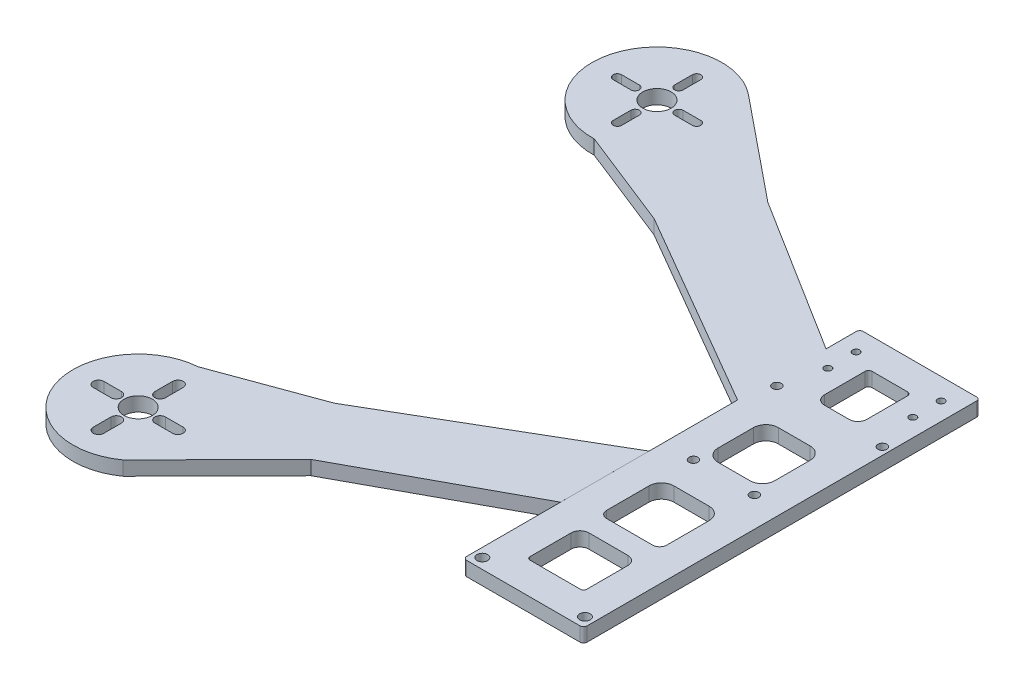
from build123d import *

# Parameters (mm, degrees)
FRAME_SKETCH_R           = 4
FRAME_SKETCH_R_2         = 1.5
FRAME_SKETCH_R_3         = 1
FRAME_SKETCH_R_4         = 1.25
FRAME_BOTTOM_PLATE_DEPTH = 4


with BuildPart() as part:
    # Frame Sketch → Frame Bottom Plate (new body)
    # profile 1 of 3: a face of its own
    with BuildSketch(Plane(origin=(0, 0, 0), x_dir=(1, 0, 0), z_dir=(0, 1, 0))):
        with BuildLine():
            Line((-17, 46.5), (-61.062067613, 74.114021758))
            Line((-61.062067613, 74.114021758), (-90.178997264, 97.745661728))
            ThreePointArc((-90.178997264, 97.745661728), (-119.163624581, 89.331166153), (-101.129958296, 65.129942282))
            Line((-101.129958296, 65.129942282), (-73.225666601, 54.114021758))
            Line((-73.225666601, 54.114021758), (-17, 21.5))
            Line((-17, 21.5), (-17, 46.5))
        make_face()
        with Locations((-101.752821055, 83.485364368)):
            Circle(FRAME_SKETCH_R, mode=Mode.SUBTRACT)
        with BuildLine():
            Line((-100.549362347, 94.665341394), (-100.549362347, 89.665341394))
            ThreePointArc((-100.549362347, 89.665341394), (-101.752821055, 88.461882686), (-102.956279762, 89.665341394))
            Line((-102.956279762, 89.665341394), (-102.956279762, 94.665341394))
            ThreePointArc((-102.956279762, 94.665341394), (-101.752821055, 95.868800102), (-100.549362347, 94.665341394))
        make_face(mode=Mode.SUBTRACT)
        with BuildLine():
            Line((-100.549362347, 72.305387341), (-100.549362347, 77.305387341))
            ThreePointArc((-100.549362347, 77.305387341), (-101.752821055, 78.508846049), (-102.956279762, 77.305387341))
            Line((-102.956279762, 77.305387341), (-102.956279762, 72.305387341))
            ThreePointArc((-102.956279762, 72.305387341), (-101.752821055, 71.101928634), (-100.549362347, 72.305387341))
        make_face(mode=Mode.SUBTRACT)
        with BuildLine():
            Line((-112.952821055, 84.685364368), (-107.952821055, 84.685364368))
            ThreePointArc((-107.952821055, 84.685364368), (-106.752821055, 83.485364368), (-107.952821055, 82.285364368))
            Line((-107.952821055, 82.285364368), (-112.952821055, 82.285364368))
            ThreePointArc((-112.952821055, 82.285364368), (-114.152821055, 83.485364368), (-112.952821055, 84.685364368))
        make_face(mode=Mode.SUBTRACT)
        with BuildLine():
            Line((-90.552821055, 84.685364368), (-95.552821055, 84.685364368))
            ThreePointArc((-95.552821055, 84.685364368), (-96.752821055, 83.485364368), (-95.552821055, 82.285364368))
            Line((-95.552821055, 82.285364368), (-90.552821055, 82.285364368))
            ThreePointArc((-90.552821055, 82.285364368), (-89.352821055, 83.485364368), (-90.552821055, 84.685364368))
        make_face(mode=Mode.SUBTRACT)
    # profile 2 of 3: a face of its own
    with BuildSketch(Plane(origin=(0, 0, 0), x_dir=(1, 0, 0), z_dir=(0, 1, 0))):
        with BuildLine():
            Line((-16, 56), (16, 56))
            ThreePointArc((16, 56), (16.707106781, 55.707106781), (17, 55))
            Line((17, 55), (17, -55))
            ThreePointArc((17, -55), (16.707106781, -55.707106781), (16, -56))
            Line((16, -56), (-16, -56))
            ThreePointArc((-16, -56), (-16.707106781, -55.707106781), (-17, -55))
            Line((-17, -55), (-17, 55))
            ThreePointArc((-17, 55), (-16.707106781, 55.707106781), (-16, 56))
        make_face()
        with Locations((-14.5, -53.1)):
            Circle(FRAME_SKETCH_R_2, mode=Mode.SUBTRACT)
        with Locations((14.5, -53.1)):
            Circle(FRAME_SKETCH_R_2, mode=Mode.SUBTRACT)
        with Locations((12, 50)):
            Circle(FRAME_SKETCH_R_3, mode=Mode.SUBTRACT)
        with Locations((12, 42)):
            Circle(FRAME_SKETCH_R_3, mode=Mode.SUBTRACT)
        with Locations((-12, 50)):
            Circle(FRAME_SKETCH_R_3, mode=Mode.SUBTRACT)
        with Locations((-12, 42)):
            Circle(FRAME_SKETCH_R_3, mode=Mode.SUBTRACT)
        with Locations((-14.9, 30.5)):
            Circle(FRAME_SKETCH_R_4, mode=Mode.SUBTRACT)
        with Locations((-8.601916271, 0.640393786)):
            Circle(FRAME_SKETCH_R_4, mode=Mode.SUBTRACT)
        with Locations((8.601916271, 0.640393786)):
            Circle(FRAME_SKETCH_R_4, mode=Mode.SUBTRACT)
        with Locations((14.9, 30.5)):
            Circle(FRAME_SKETCH_R_4, mode=Mode.SUBTRACT)
        with BuildLine():
            Line((-7.140393786, -47), (7.140393786, -47))
            ThreePointArc((7.140393786, -47), (7.748227169, -46.748227169), (8, -46.140393786))
            Line((8, -46.140393786), (8, -34.5))
            ThreePointArc((8, -34.5), (7.267766953, -32.732233047), (5.5, -32))
            Line((5.5, -32), (-5.5, -32))
            ThreePointArc((-5.5, -32), (-7.267766953, -32.732233047), (-8, -34.5))
            Line((-8, -34.5), (-8, -46.140393786))
            ThreePointArc((-8, -46.140393786), (-7.748227169, -46.748227169), (-7.140393786, -47))
        make_face(mode=Mode.SUBTRACT)
        with BuildLine():
            Line((6.5, -26), (-6.5, -26))
            ThreePointArc((-6.5, -26), (-7.914213562, -25.414213562), (-8.5, -24))
            Line((-8.5, -24), (-8.5, -12))
            ThreePointArc((-8.5, -12), (-7.474873734, -9.525126266), (-5, -8.5))
            Line((-5, -8.5), (5, -8.5))
            ThreePointArc((5, -8.5), (7.474873734, -9.525126266), (8.5, -12))
            Line((8.5, -12), (8.5, -24))
            ThreePointArc((8.5, -24), (7.914213562, -25.414213562), (6.5, -26))
        make_face(mode=Mode.SUBTRACT)
        with BuildLine():
            Line((-4.5, 3.5), (4.5, 3.5))
            ThreePointArc((4.5, 3.5), (6.974873734, 4.525126266), (8, 7))
            Line((8, 7), (8, 17))
            ThreePointArc((8, 17), (6.974873734, 19.474873734), (4.5, 20.5))
            Line((4.5, 20.5), (-4.5, 20.5))
            ThreePointArc((-4.5, 20.5), (-6.974873734, 19.474873734), (-8, 17))
            Line((-8, 17), (-8, 7))
            ThreePointArc((-8, 7), (-6.974873734, 4.525126266), (-4.5, 3.5))
        make_face(mode=Mode.SUBTRACT)
        with BuildLine():
            Line((-3.5, 32.5), (3.5, 32.5))
            ThreePointArc((3.5, 32.5), (5.267766953, 33.232233047), (6, 35))
            Line((6, 35), (6, 46.5))
            ThreePointArc((6, 46.5), (5.707106781, 47.207106781), (5, 47.5))
            Line((5, 47.5), (-5, 47.5))
            ThreePointArc((-5, 47.5), (-5.707106781, 47.207106781), (-6, 46.5))
            Line((-6, 46.5), (-6, 35))
            ThreePointArc((-6, 35), (-5.267766953, 33.232233047), (-3.5, 32.5))
        make_face(mode=Mode.SUBTRACT)
    # profile 3 of 3: a face of its own
    with BuildSketch(Plane(origin=(0, 0, 0), x_dir=(1, 0, 0), z_dir=(0, 1, 0))):
        with BuildLine():
            Line((-62.716323121, -53.281543085), (-89.097855804, -79.932335442))
            ThreePointArc((-89.097855804, -79.932335442), (-117.171371962, -71.292831267), (-101.325361156, -46.560923064))
            Line((-101.325361156, -46.560923064), (-73.161757849, -36.225960617))
            Line((-73.161757849, -36.225960617), (-17.001171136, -3.499999973))
            Line((-17.001171136, -3.499999973), (-17.001171136, -28.499999973))
            Line((-17.001171136, -28.499999973), (-62.716323121, -53.281543085))
        make_face()
        with Locations((-99.852332897, -64.947021253)):
            Circle(FRAME_SKETCH_R, mode=Mode.SUBTRACT)
        with BuildLine():
            Line((-98.352332897, -53.747021253), (-98.352332897, -58.747021253))
            ThreePointArc((-98.352332897, -58.747021253), (-99.852332897, -60.247021253), (-101.352332897, -58.747021253))
            Line((-101.352332897, -58.747021253), (-101.352332897, -53.747021253))
            ThreePointArc((-101.352332897, -53.747021253), (-99.852332897, -52.247021253), (-98.352332897, -53.747021253))
        make_face(mode=Mode.SUBTRACT)
        with BuildLine():
            Line((-98.352332897, -76.147021253), (-98.352332897, -71.147021253))
            ThreePointArc((-98.352332897, -71.147021253), (-99.852332897, -69.647021253), (-101.352332897, -71.147021253))
            Line((-101.352332897, -71.147021253), (-101.352332897, -76.147021253))
            ThreePointArc((-101.352332897, -76.147021253), (-99.852332897, -77.647021253), (-98.352332897, -76.147021253))
        make_face(mode=Mode.SUBTRACT)
        with BuildLine():
            Line((-111.052332897, -63.447021253), (-106.052332897, -63.447021253))
            ThreePointArc((-106.052332897, -63.447021253), (-104.552332897, -64.947021253), (-106.052332897, -66.447021253))
            Line((-106.052332897, -66.447021253), (-111.052332897, -66.447021253))
            ThreePointArc((-111.052332897, -66.447021253), (-112.552332897, -64.947021253), (-111.052332897, -63.447021253))
        make_face(mode=Mode.SUBTRACT)
        with BuildLine():
            Line((-88.652332897, -63.447021253), (-93.652332897, -63.447021253))
            ThreePointArc((-93.652332897, -63.447021253), (-95.152332897, -64.947021253), (-93.652332897, -66.447021253))
            Line((-93.652332897, -66.447021253), (-88.652332897, -66.447021253))
            ThreePointArc((-88.652332897, -66.447021253), (-87.152332897, -64.947021253), (-88.652332897, -63.447021253))
        make_face(mode=Mode.SUBTRACT)
    extrude(amount=FRAME_BOTTOM_PLATE_DEPTH)


solid = part.part
